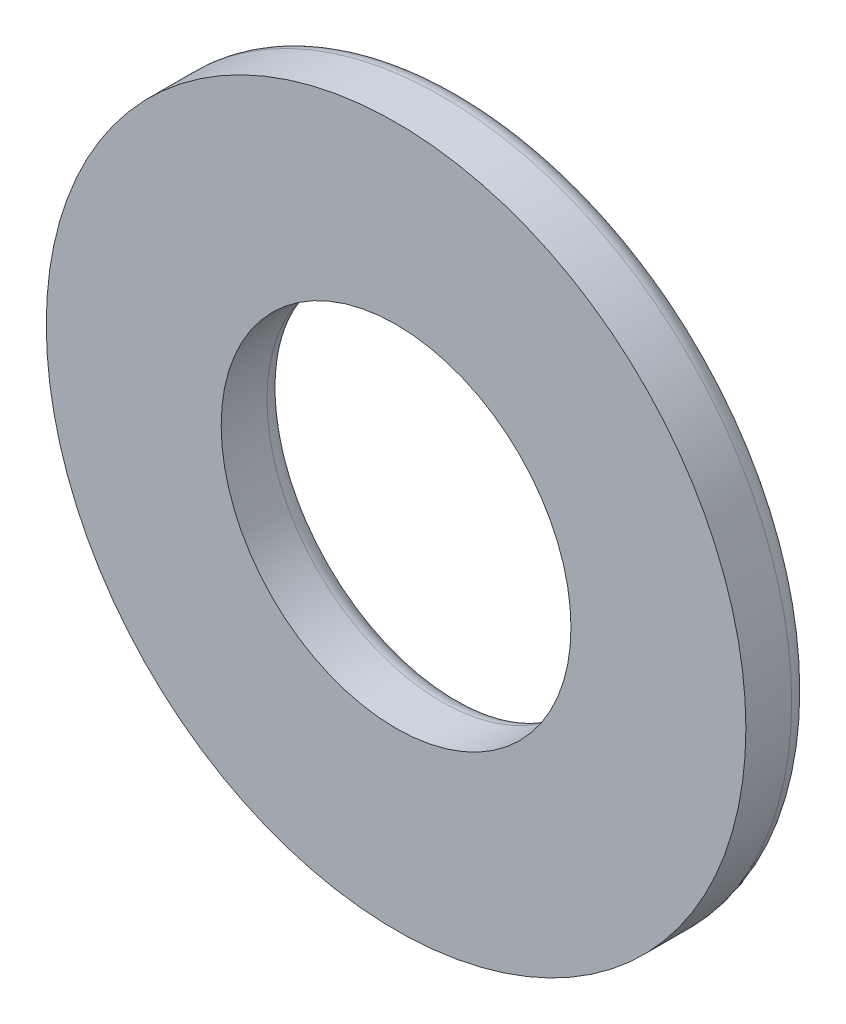
from build123d import *

# Parameters (mm, degrees)
SKETCH1_R           = 13.589
SKETCH1_R_2         = 6.7945
BOSS_EXTRUDE1_DEPTH = 2.54
FILLET1_R           = 0.762


with BuildPart() as part:
    # Sketch1 → Boss-Extrude1 (new body)
    with BuildSketch(Plane.XY):
        Circle(SKETCH1_R)
        Circle(SKETCH1_R_2, mode=Mode.SUBTRACT)
    extrude(amount=BOSS_EXTRUDE1_DEPTH)

    # Fillet1
    fillet1_edges = [part.edges().sort_by_distance(p)[0] for p in [
        (-6.7945, 0, 0),
        (-13.589, 0, 0),
    ]]
    fillet(fillet1_edges, radius=FILLET1_R)


solid = part.part
